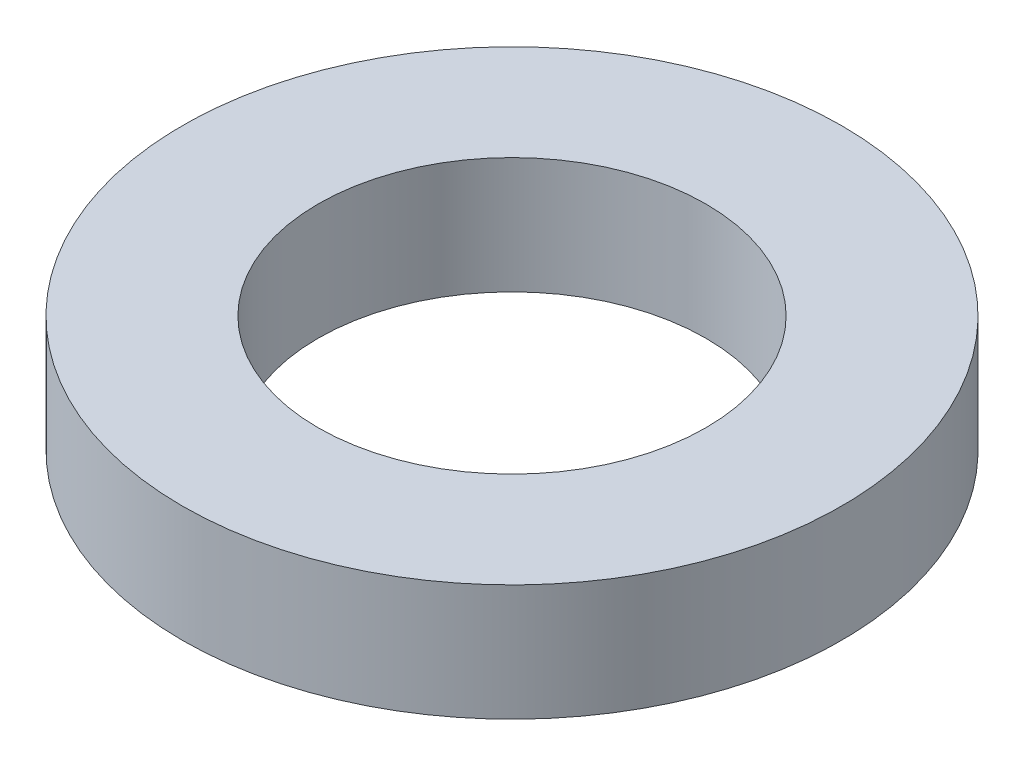
from build123d import *

# Parameters (mm, degrees)
SKETCH1_R           = 85
BOSS_EXTRUDE1_DEPTH = 30
SKETCH2_R           = 50
CUT_EXTRUDE1_DEPTH  = 124.895116934


with BuildPart() as part:
    # Sketch1 → Boss-Extrude1 (new body)
    with BuildSketch(Plane(origin=(0, 0, 0), x_dir=(1, 0, 0), z_dir=(0, 1, 0))):
        Circle(SKETCH1_R)
    extrude(amount=BOSS_EXTRUDE1_DEPTH)

    # Sketch2 → Cut-Extrude1 (cut, through all)
    with BuildSketch(Plane(origin=(0, 0, 0), x_dir=(1, 0, 0), z_dir=(0, 1, 0))):
        Circle(SKETCH2_R)
    extrude(amount=CUT_EXTRUDE1_DEPTH, mode=Mode.SUBTRACT)


solid = part.part
